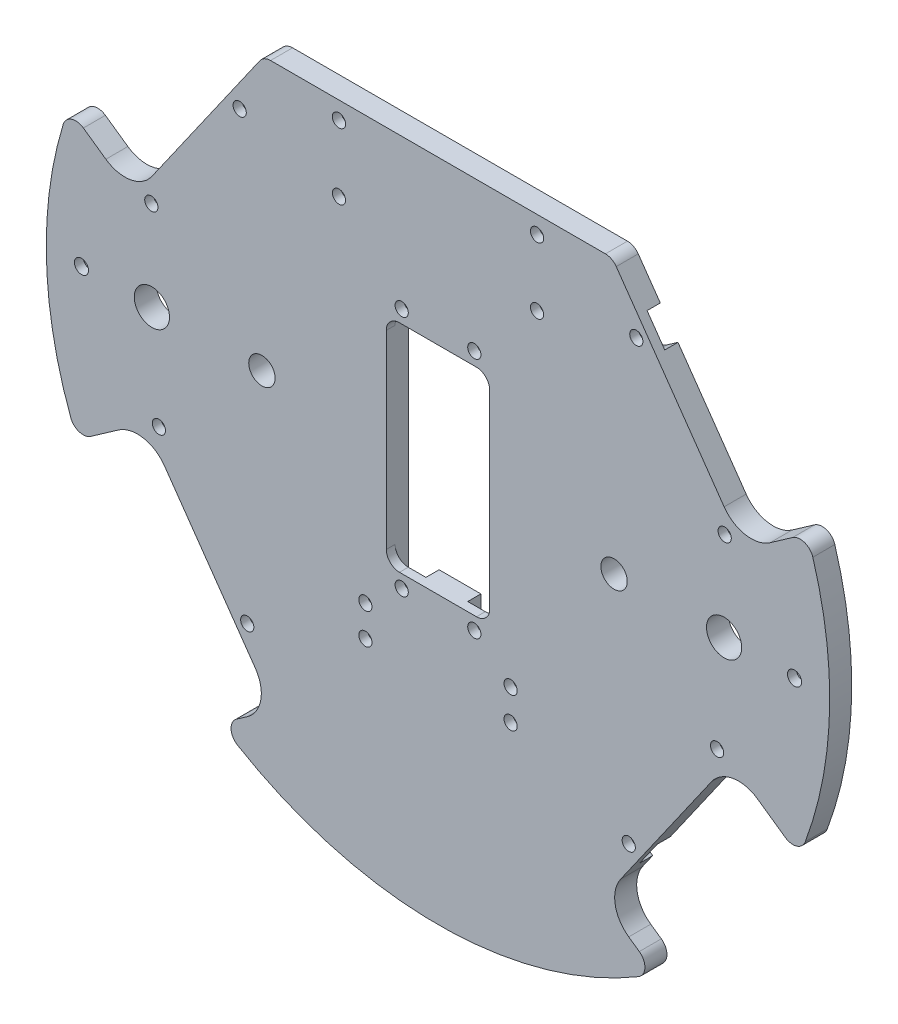
from build123d import *

# Parameters (mm, degrees)
SKETCH_1_R                  = 89
EXTRUDE_1_DEPTH             = 5
HOLE_WIZARD_8_D             = 3
HOLE_WIZARD_8_CBORE_D       = 7
HOLE_WIZARD_8_CBORE_DEPTH   = 3
CUT_EXTRUDE_2_DEPTH         = 10
CUT_EXTRUDE_3_DEPTH         = 10
HOLE_WIZARD_8_2_D           = 3
HOLE_WIZARD_8_2_CBORE_D     = 7
HOLE_WIZARD_8_2_CBORE_DEPTH = 3
SKETCH_27_W                 = 23.5
SKETCH_27_H                 = 49.1
CUT_EXTRUDE_4_DEPTH         = 10
FILLET_1_R                  = 3
HOLE_WIZARD_1_0_1_1_D       = 3
FILLET_2_DEPTH              = 5
FILLET_START                = 3
FILLET_2_2_DEPTH            = 2
CUT_EXTRUDE_8_DEPTH         = 3
CUT_EXTRUDE_11_DEPTH        = 3
CUT_EXTRUDE_9_DEPTH         = 3
HOLE_WIZARD_8_3_D           = 3.2
HOLE_WIZARD_8_3_CBORE_D     = 7.5
HOLE_WIZARD_8_3_CBORE_DEPTH = 3
SKETCH_50_R                 = 3
SKETCH_50_R_2               = 4
CUT_EXTRUDE_10_DEPTH        = 126.964280651


with BuildPart() as part:
    # 草图1 → 拉伸1 (new body)
    with BuildSketch(Plane.XY):
        Circle(SKETCH_1_R)
    extrude(amount=EXTRUDE_1_DEPTH)

    # Hole Wizard 8 (through all)
    with Locations(Plane(origin=(45.056156837, 48.977181137, 0), x_dir=(-1, 0, 0), z_dir=(0, 0, -1))):
        with Locations((0, 0), (-20.075175273, -28.67032155), (1.720729309, -100.411818407), (-18.354445964, -71.741496856)):
            hole_wizard_8 = CounterBoreHole(HOLE_WIZARD_8_D / 2, HOLE_WIZARD_8_CBORE_D / 2, HOLE_WIZARD_8_CBORE_DEPTH)

    # 镜向6: Hole Wizard 8 across plane
    add(hole_wizard_8.mirror(Plane(origin=(0, 0, 0), x_dir=(0, 0, 1), z_dir=(1, 0, 0))), mode=Mode.SUBTRACT)

    # 草图21 → Cut-Extrude 2 (cut)
    with BuildSketch(Plane(origin=(0, 0, 0), x_dir=(-1, 0, 0), z_dir=(0, 0, -1))):
        with BuildLine():
            Line((-39.599804667, 62), (39.599804667, 62))
            Line((39.599804667, 62), (69.309517552, 19.570132763))
            Line((69.309517552, 19.570132763), (83.87400404, 29.768295992))
            ThreePointArc((83.87400404, 29.768295992), (0, 89), (-83.87400404, 29.768295992))
            Line((-83.87400404, 29.768295992), (-69.309517552, 19.570132763))
            Line((-69.309517552, 19.570132763), (-39.599804667, 62))
        make_face()
    extrude(amount=-CUT_EXTRUDE_2_DEPTH, mode=Mode.SUBTRACT)

    # 草图22 → Cut-Extrude 3 (cut)
    with BuildSketch(Plane(origin=(0, 0, 0), x_dir=(-1, 0, 0), z_dir=(0, 0, -1))):
        with BuildLine():
            Line((-82.012277652, -34.568574085), (-66.44163537, -23.665892984))
            Line((-66.44163537, -23.665892984), (-37.189237116, -65.442647243))
            Line((-37.189237116, -65.442647243), (-49.428242542, -74.012491103))
            ThreePointArc((-49.428242542, -74.012491103), (-68.615655901, -56.682376144), (-82.012277652, -34.568574085))
        make_face()
    cut_extrude_3 = extrude(amount=-CUT_EXTRUDE_3_DEPTH, mode=Mode.SUBTRACT)

    # 镜向7: Cut-Extrude 3 across plane
    add(cut_extrude_3.mirror(Plane(origin=(0, 0, 0), x_dir=(0, 0, 1), z_dir=(1, 0, 0))), mode=Mode.SUBTRACT)

    # Hole Wizard 8 2 (through all)
    with Locations(Plane(origin=(22.5, 58, 0), x_dir=(-1, 0, 0), z_dir=(0, 0, -1))):
        with Locations((0, 0), (0, -15), (45, -15), (45, 0), (-127.702769625, 168.922663635)):
            CounterBoreHole(HOLE_WIZARD_8_2_D / 2, HOLE_WIZARD_8_2_CBORE_D / 2, HOLE_WIZARD_8_2_CBORE_DEPTH)

    # 草图27 → Cut-Extrude 4 (cut)
    with BuildSketch(Plane(origin=(0, 0, 0), x_dir=(-1, 0, 0), z_dir=(0, 0, -1))):
        with Locations((0, 0.5)):
            Rectangle(SKETCH_27_W, SKETCH_27_H)
    extrude(amount=-CUT_EXTRUDE_4_DEPTH, mode=Mode.SUBTRACT)

    # 圆角1
    fillet_1_edges = [part.edges().sort_by_distance(p)[0] for p in [
        (82.012277652, -34.568574085, 2.5),
        (49.428242542, -74.012491103, 2.5),
        (-82.012277652, -34.568574085, 2.5),
        (-49.428242542, -74.012491103, 2.5),
        (11.75, -24.05, 2.5),
        (11.75, 25.05, 2.5),
        (-11.75, 25.05, 2.5),
        (-11.75, -24.05, 2.5),
        (39.599804667, 62, 2.5),
        (83.87400404, 29.768295992, 2.5),
        (-83.87400404, 29.768295992, 2.5),
        (-39.599804667, 62, 2.5),
    ]]
    fillet(fillet_1_edges, radius=FILLET_1_R)

    # Ø1.0 (1) 直径孔1 (through all)
    with Locations(Plane(origin=(8.25, 28, 0), x_dir=(-1, 0, 0), z_dir=(0, 0, -1))):
        with Locations((0, 0), (16.5, 0), (-8.25, -62), (24.75, -62), (0, -55), (16.5, -55), (-8.25, -69), (24.75, -69)):
            Hole(HOLE_WIZARD_1_0_1_1_D / 2)

    # 圆角2: read off the stored shape, not the designer's step
    # 圆角2 outline → 圆角2 (add)
    with BuildSketch(Plane.XY):
        with BuildLine():
            Line((-37.189237116, -65.442647243), (-41.491060389, -59.299006911))
            ThreePointArc((-41.491060389, -59.299006911), (-40.248642573, -64.903191516), (-43.332877448, -69.744470516))
            Line((-43.332877448, -69.744470516), (-37.189237116, -65.442647243))
        make_face()
        with BuildLine():
            ThreePointArc((-64.834029308, -25.961792377), (-66.003394893, -25.115364244), (-66.73169872, -23.868997528))
            Line((-66.73169872, -23.868997528), (-72.585275702, -27.967716257))
            ThreePointArc((-72.585275702, -27.967716257), (-66.981091097, -26.725298441), (-62.139812097, -29.809533316))
            Line((-62.139812097, -29.809533316), (-64.834029308, -25.961792377))
        make_face()
        with BuildLine():
            ThreePointArc((-68.622817869, 20.550841547), (-67.998364265, 22.314377114), (-66.554758617, 23.504336245))
            Line((-66.554758617, 23.504336245), (-65.007694279, 25.713773095))
            ThreePointArc((-65.007694279, 25.713773095), (-69.848973279, 22.62953822), (-75.453157884, 23.871956035))
            Line((-75.453157884, 23.871956035), (-69.309517552, 19.570132763))
            Line((-69.309517552, 19.570132763), (-68.622817869, 20.550841547))
        make_face()
        with BuildLine():
            ThreePointArc((75.453157884, 23.871956035), (69.848973279, 22.62953822), (65.007694279, 25.713773095))
            Line((65.007694279, 25.713773095), (66.554758617, 23.504336245))
            ThreePointArc((66.554758617, 23.504336245), (67.998364265, 22.314377114), (68.622817869, 20.550841547))
            Line((68.622817869, 20.550841547), (69.309517552, 19.570132763))
            Line((69.309517552, 19.570132763), (75.453157884, 23.871956035))
        make_face()
        with BuildLine():
            ThreePointArc((43.332877448, -69.744470516), (40.248642573, -64.903191516), (41.491060389, -59.299006911))
            Line((41.491060389, -59.299006911), (37.189237116, -65.442647243))
            Line((37.189237116, -65.442647243), (43.332877448, -69.744470516))
        make_face()
        with BuildLine():
            ThreePointArc((62.139812097, -29.809533316), (66.981091097, -26.725298441), (72.585275702, -27.967716257))
            Line((72.585275702, -27.967716257), (66.73169872, -23.868997528))
            ThreePointArc((66.73169872, -23.868997528), (66.003394893, -25.115364244), (64.834029308, -25.961792377))
            Line((64.834029308, -25.961792377), (62.139812097, -29.809533316))
        make_face()
    extrude(amount=FILLET_2_DEPTH)

    # Fillet 2 2 outline → Fillet 2 2 (add)
    with BuildSketch(Plane.XY.offset(FILLET_START)):
        with BuildLine():
            Line((-66.44163537, -23.665892984), (-66.73169872, -23.868997528))
            ThreePointArc((-66.73169872, -23.868997528), (-66.003394893, -25.115364244), (-64.834029308, -25.961792377))
            Line((-64.834029308, -25.961792377), (-66.44163537, -23.665892984))
        make_face()
        with BuildLine():
            Line((-68.622817869, 20.550841547), (-66.554758617, 23.504336245))
            ThreePointArc((-66.554758617, 23.504336245), (-67.998364265, 22.314377114), (-68.622817869, 20.550841547))
        make_face()
        with BuildLine():
            ThreePointArc((68.622817869, 20.550841547), (67.998364265, 22.314377114), (66.554758617, 23.504336245))
            Line((66.554758617, 23.504336245), (68.622817869, 20.550841547))
        make_face()
        with BuildLine():
            ThreePointArc((64.834029308, -25.961792377), (66.003394893, -25.115364244), (66.73169872, -23.868997528))
            Line((66.73169872, -23.868997528), (66.44163537, -23.665892984))
            Line((66.44163537, -23.665892984), (64.834029308, -25.961792377))
        make_face()
    extrude(amount=FILLET_2_2_DEPTH)

    # 草图46 → 切除-拉伸8 (cut)
    with BuildSketch(Plane(origin=(0, 0, 0), x_dir=(-1, 0, 0), z_dir=(0, 0, -1))):
        with BuildLine():
            Line((-4.75, 28), (-4.75, -27))
            ThreePointArc((-4.75, -27), (-8.25, -30.5), (-11.75, -27))
            Line((-11.75, -27), (-11.75, 28))
            ThreePointArc((-11.75, 28), (-8.25, 31.5), (-4.75, 28))
        make_face()
        with BuildLine():
            Line((11.75, 28), (11.75, -27))
            ThreePointArc((11.75, -27), (8.25, -30.5), (4.75, -27))
            Line((4.75, -27), (4.75, 28))
            ThreePointArc((4.75, 28), (8.25, 31.5), (11.75, 28))
        make_face()
    extrude(amount=-CUT_EXTRUDE_8_DEPTH, mode=Mode.SUBTRACT)

    # 草图51 → 切除-拉伸11 (cut)
    with BuildSketch(Plane(origin=(0, 0, 0), x_dir=(-1, 0, 0), z_dir=(0, 0, -1))):
        with BuildLine():
            Line((-13, -34), (-13, -41))
            ThreePointArc((-13, -41), (-16.5, -44.5), (-20, -41))
            Line((-20, -41), (-20, -34))
            ThreePointArc((-20, -34), (-16.5, -30.5), (-13, -34))
        make_face()
    cut_extrude_11 = extrude(amount=-CUT_EXTRUDE_11_DEPTH, mode=Mode.SUBTRACT)

    # 镜向8: 切除-拉伸11 across plane
    add(cut_extrude_11.mirror(Plane(origin=(0, 0, 0), x_dir=(0, 0, 1), z_dir=(1, 0, 0))), mode=Mode.SUBTRACT)

    # 草图47 → 切除-拉伸9 (cut)
    with BuildSketch(Plane(origin=(0, 0, 0), x_dir=(-1, 0, 0), z_dir=(0, 0, -1))):
        with BuildLine():
            Line((-41.327910001, -54.301669425), (-43.785366134, -56.022398734))
            ThreePointArc((-43.785366134, -56.022398734), (-48.659915816, -55.162884106), (-47.800401188, -50.288334424))
            Line((-47.800401188, -50.288334424), (-45.342945056, -48.567605115))
            ThreePointArc((-45.342945056, -48.567605115), (-40.468395373, -49.427119742), (-41.327910001, -54.301669425))
        make_face()
        with BuildLine():
            Line((-47.063674365, 46.110148982), (-49.521130497, 47.830878291))
            ThreePointArc((-49.521130497, 47.830878291), (-50.380645125, 52.705427973), (-45.506095443, 53.564942601))
            Line((-45.506095443, 53.564942601), (-43.04863931, 51.844213292))
            ThreePointArc((-43.04863931, 51.844213292), (-42.189124682, 46.969663609), (-47.063674365, 46.110148982))
        make_face()
        with BuildLine():
            Line((43.04863931, 51.844213292), (45.506095443, 53.564942601))
            ThreePointArc((45.506095443, 53.564942601), (50.380645125, 52.705427973), (49.521130497, 47.830878291))
            Line((49.521130497, 47.830878291), (47.063674365, 46.110148982))
            ThreePointArc((47.063674365, 46.110148982), (42.189124682, 46.969663609), (43.04863931, 51.844213292))
        make_face()
        with BuildLine():
            Line((45.342945056, -48.567605115), (47.800401188, -50.288334424))
            ThreePointArc((47.800401188, -50.288334424), (48.659915816, -55.162884106), (43.785366134, -56.022398734))
            Line((43.785366134, -56.022398734), (41.327910001, -54.301669425))
            ThreePointArc((41.327910001, -54.301669425), (40.468395373, -49.427119742), (45.342945056, -48.567605115))
        make_face()
    extrude(amount=-CUT_EXTRUDE_9_DEPTH, mode=Mode.SUBTRACT)

    # Hole Wizard 8 3 (through all)
    with Locations(Plane(origin=(81, 0, 0), x_dir=(-1, 0, 0), z_dir=(0, 0, -1))):
        with Locations((0, 0), (162, 0)):
            CounterBoreHole(HOLE_WIZARD_8_3_D / 2, HOLE_WIZARD_8_3_CBORE_D / 2, HOLE_WIZARD_8_3_CBORE_DEPTH)

    # 草图50 → 切除-拉伸10 (cut, through all)
    with BuildSketch(Plane(origin=(0, 0, 0), x_dir=(-1, 0, 0), z_dir=(0, 0, -1))):
        with Locations((-40.001582071, 0)):
            Circle(SKETCH_50_R)
        with Locations((40, 0)):
            Circle(SKETCH_50_R)
        with Locations((-65, 0)):
            Circle(SKETCH_50_R_2)
        with Locations((65, 0)):
            Circle(SKETCH_50_R_2)
    extrude(amount=-CUT_EXTRUDE_10_DEPTH, mode=Mode.SUBTRACT)


solid = part.part
